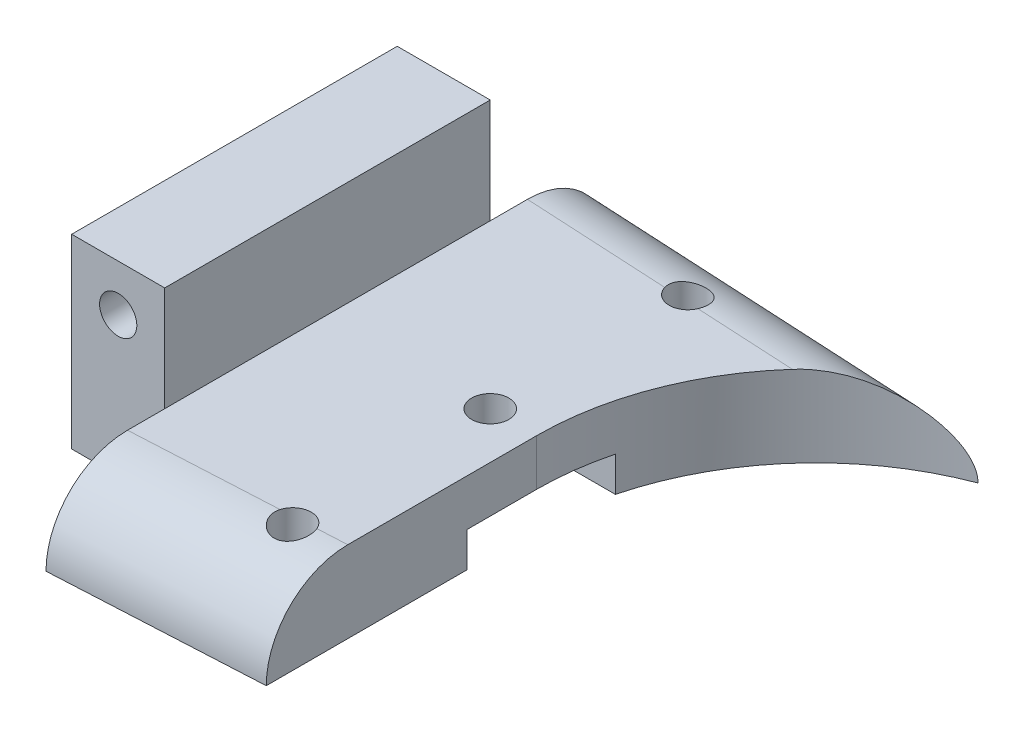
from build123d import *

# Parameters (mm, degrees)
BOSS_EXTRUDE1_DEPTH = 3.5
SKETCH2_R           = 0.8
SCREW_HOLES_DEPTH   = 37.028935124
SKETCH3_W           = 4
SKETCH3_H           = 14
BOSS_EXTRUDE2_DEPTH = 8
WIRE_CANAL_DEPTH    = 1.5
CUT_EXTRUDE2_START  = 13
SKETCH5_R           = 0.8
CUT_EXTRUDE2_DEPTH  = 50.74008936
FILLET1_R           = 3.5


with BuildPart() as part:
    # Sketch1 → Boss-Extrude1 (new body)
    with BuildSketch(Plane(origin=(0, 0, 0), x_dir=(1, 0, 0), z_dir=(0, 1, 0))):
        with BuildLine():
            Line((17, -10), (17, -12.105263158))
            Line((17, -12.105263158), (26, -11.631578947))
            Line((26, -11.631578947), (26, 0))
            ThreePointArc((26, 0), (28.126845638, 6.820617489), (33.753470489, 11.223501553))
            Line((33.753470489, 11.223501553), (17, 12.105263158))
            Line((17, 12.105263158), (17, 10))
            Line((17, 10), (17, 7))
            Line((17, 7), (13, 7))
            Line((13, 7), (13, 0))
            Line((13, 0), (13, -7))
            Line((13, -7), (17, -7))
            Line((17, -7), (17, -10))
        make_face()
    extrude(amount=BOSS_EXTRUDE1_DEPTH)

    # Sketch2 → Screw Holes (cut, through all)
    with BuildSketch(Plane(origin=(0, 0, 0), x_dir=(1, 0, 0), z_dir=(0, 1, 0))):
        with Locations(Location((24, 8.5, 0), (0, 0, 270))):
            Circle(SKETCH2_R)
        with Locations(Location((24, 0, 0), (0, 0, 270))):
            Circle(SKETCH2_R)
        with Locations(Location((24, -8.5, 0), (0, 0, 270))):
            Circle(SKETCH2_R)
    extrude(amount=SCREW_HOLES_DEPTH, mode=Mode.SUBTRACT)

    # Sketch3 → Boss-Extrude2 (add)
    with BuildSketch(Plane(origin=(0, 0, 0), x_dir=(1, 0, 0), z_dir=(0, 1, 0))):
        with Locations((15, 0)):
            Rectangle(SKETCH3_W, SKETCH3_H)
    extrude(amount=BOSS_EXTRUDE2_DEPTH)

    # Sketch4 → Wire Canal (cut)
    with BuildSketch(Plane(origin=(0, 0, 0), x_dir=(1, 0, 0), z_dir=(0, 1, 0))):
        Polygon((13, 0), (13, 3), (26.381049961, 3), (26.381049961, -3), (13, -3), align=None)
    extrude(amount=WIRE_CANAL_DEPTH, mode=Mode.SUBTRACT)

    # Sketch5 → Cut-Extrude2 (cut, through all)
    with BuildSketch(Plane.XY.offset(CUT_EXTRUDE2_START)):
        with Locations(Location((15, 6, 0), (0, 0, 180))):
            Circle(SKETCH5_R)
    extrude(amount=-CUT_EXTRUDE2_DEPTH, mode=Mode.SUBTRACT)

    # Fillet1
    # the kernel refuses this fillet: 3.5 mm, written as the material it takes off along each edge
    with BuildSketch(Plane(origin=(8.262093993, 3.5, 12.565152948), x_dir=(0, -1, 0), z_dir=(0.9986178293325098, 0, -0.05255883312276359))) as fillet1_piece_1:
        with BuildLine():
            CenterArc((FILLET1_R, FILLET1_R), FILLET1_R, 180, 90)
            Line((0, FILLET1_R), (0, 0))
            Line((0, 0), (FILLET1_R, 0))
        make_face()
    extrude(amount=26.512456753, mode=Mode.SUBTRACT)
    with BuildSketch(Plane(origin=(42.491376496, 3.5, -10.763611763), x_dir=(-0.05255883312276374, 0, 0.9986178293325098), z_dir=(-0.9986178293325098, 0, -0.05255883312276374))) as fillet1_piece_2:
        with BuildLine():
            CenterArc((FILLET1_R, -FILLET1_R), FILLET1_R, 90, 90)
            Line((0, -FILLET1_R), (0, 0))
            Line((0, 0), (FILLET1_R, 0))
        make_face()
    extrude(amount=34.276658695, mode=Mode.SUBTRACT)


solid = part.part
